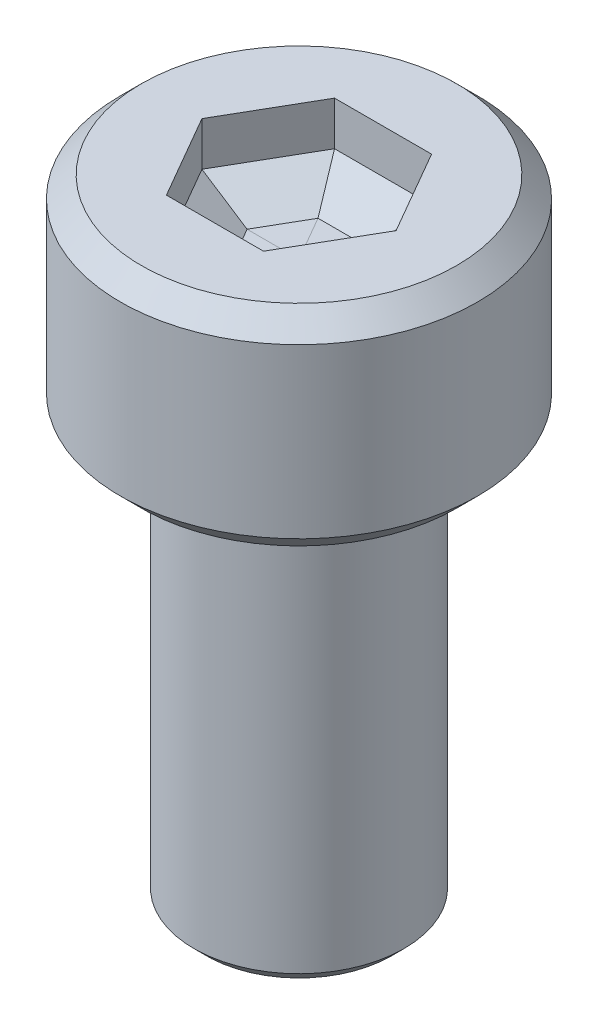
from build123d import *

# Parameters (mm, degrees)
REDONDEO1_R          = 0.2
CHAFL_N1_SIZE        = 0.3
CHAFL_N2_SIZE        = 0.5
CORTAR_BARRER1_START = 3.956316317
CORTAR_BARRER1_DEPTH = 1.043683683


with BuildPart() as part:
    # Croquis1 → Revolución1 (revolve)
    with BuildSketch(Plane.XY):
        Polygon((0, 0), (0, -10), (2.5, -10), (2.5, 0), (4.25, 0), (4.25, 5), (0, 5), align=None)
    revolve(axis=Axis((0, -1001.198752701, 0), (0, 1, 0)))

    # Redondeo1
    redondeo1_edges = [part.edges().sort_by_distance(p)[0] for p in [
        (-2.5, 0, 0),
    ]]
    fillet(redondeo1_edges, radius=REDONDEO1_R)

    # Chaflán1
    chafl_n1_edges = [part.edges().sort_by_distance(p)[0] for p in [
        (-2.5, -10, 0),
    ]]
    chamfer(chafl_n1_edges, length=CHAFL_N1_SIZE)

    # Chaflán2
    chafl_n2_edges = [part.edges().sort_by_distance(p)[0] for p in [
        (-4.25, 5, 0),
        (-4.25, 0, 0),
    ]]
    chamfer(chafl_n2_edges, length=CHAFL_N2_SIZE)

    # Cortar-Barrer1: read off the stored shape, not the designer's step
    # Cortar-Barrer1 outline → Cortar-Barrer1 (cut)
    with BuildSketch(Plane(origin=(0, 0, 0), x_dir=(1, 0, 0), z_dir=(0, 1, 0)).offset(CORTAR_BARRER1_START)):
        Polygon((1.154700538, 2), (-1.154700538, 2), (-2.309401077, 0), (-1.154700538, -2), (1.154700538, -2), (2.309401077, 0), align=None)
    extrude(amount=CORTAR_BARRER1_DEPTH, mode=Mode.SUBTRACT)

    # Cortar-Barrer1 2: loft between two sections, ruled curve by curve
    cortar_barrer1_2_from = [
        Edge.make_line((-2.309401077, 3.956316317, 0), (-1.154700538, 3.956316317, -2)),
        Edge.make_line((-1.154700538, 3.956316317, 2), (-2.309401077, 3.956316317, 0)),
        Edge.make_line((-1.154700538, 3.956316317, -2), (1.154700538, 3.956316317, -2)),
        Edge.make_line((1.154700538, 3.956316317, 2), (-1.154700538, 3.956316317, 2)),
        Edge.make_line((1.154700538, 3.956316317, -2), (2.309401077, 3.956316317, 0)),
        Edge.make_line((2.309401077, 3.956316317, 0), (1.154700538, 3.956316317, 2)),
    ]
    cortar_barrer1_2_to = [
        Edge.make_line((-1.235376897, 3.257522104, 0), (-0.617688448, 3.257522104, -1.069867776)),
        Edge.make_line((-0.617688448, 3.257522104, 1.069867776), (-1.235376897, 3.257522104, 0)),
        Edge.make_line((-0.617688448, 3.257522104, -1.069867776), (0.617688448, 3.257522104, -1.069867776)),
        Edge.make_line((0.617688448, 3.257522104, 1.069867776), (-0.617688448, 3.257522104, 1.069867776)),
        Edge.make_line((0.617688448, 3.257522104, -1.069867776), (1.235376897, 3.257522104, 0)),
        Edge.make_line((1.235376897, 3.257522104, 0), (0.617688448, 3.257522104, 1.069867776)),
    ]
    cortar_barrer1_2 = Solid(Shell([*[Face.make_surface_from_curves(cortar_barrer1_2_from[k], cortar_barrer1_2_to[k]) for k in range(6)], Face(Wire(cortar_barrer1_2_from)), Face(Wire(cortar_barrer1_2_to))]))
    add(cortar_barrer1_2, mode=Mode.SUBTRACT)


solid = part.part
